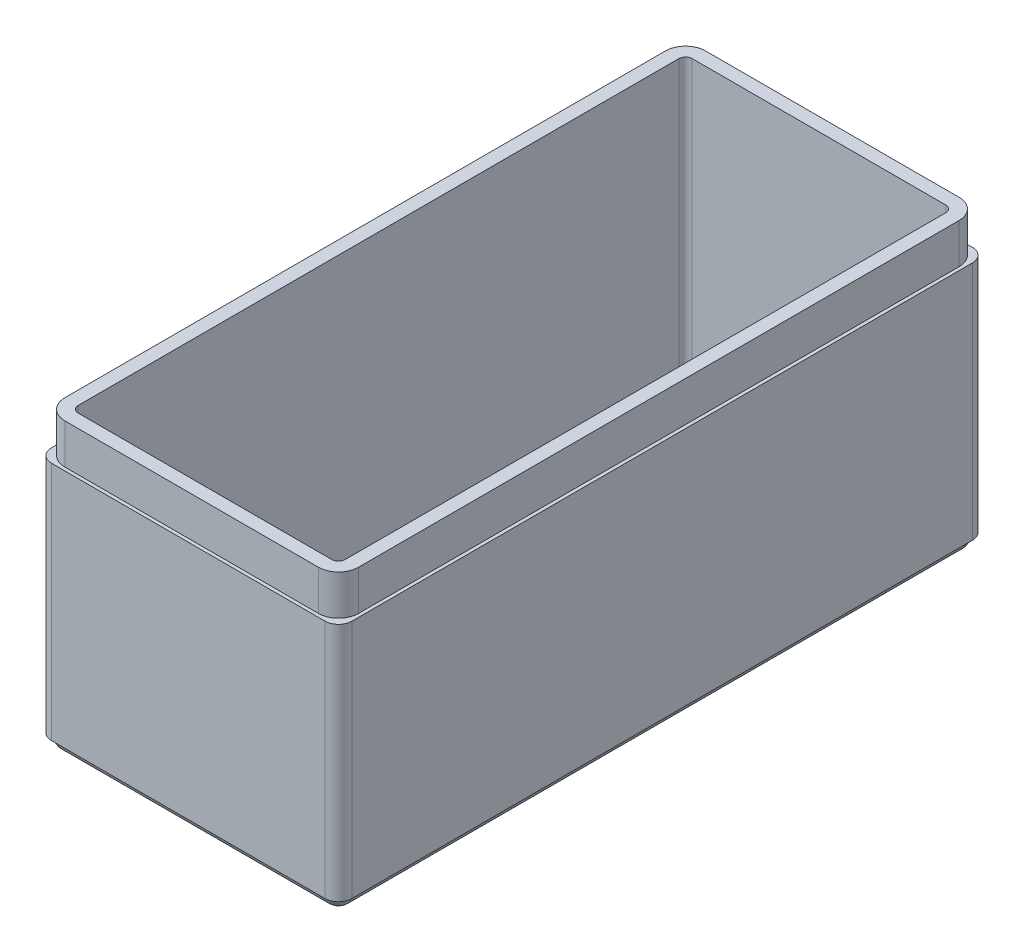
from build123d import *

# Parameters (mm, degrees)
SKETCH1_W           = 45
SKETCH1_H           = 97
BOSS_EXTRUDE1_DEPTH = 19
SKETCH2_W           = 44
SKETCH2_H           = 96
BOSS_EXTRUDE2_DEPTH = 6
SKETCH3_W           = 45
SKETCH3_H           = 97
SKETCH3_W_2         = 44
SKETCH3_H_2         = 96
CUT_EXTRUDE1_DEPTH  = 2
FILLET1_R           = 2
FILLET4_R           = 3
FILLET5_R           = 2
SHELL2_START        = -17
SHELL2_DEPTH        = 42
SHELL2_2_OUTLINE_W  = 41
SHELL2_2_OUTLINE_H  = 93
SHELL2_2_DEPTH      = 34
BOSS_EXTRUDE3_START = 34
SKETCH4_W           = 41
SKETCH4_H           = 93
BOSS_EXTRUDE3_DEPTH = 34


# Read off the part's stored shape, not the designer's step: Shell2
with BuildPart() as part:
    # Sketch1 → Boss-Extrude1 (new, symmetric)
    with BuildSketch(Plane(origin=(0, 0, 0), x_dir=(1, 0, 0), z_dir=(0, 1, 0))):
        Rectangle(SKETCH1_W, SKETCH1_H)
    extrude(amount=BOSS_EXTRUDE1_DEPTH, both=True)

    # Sketch2 → Boss-Extrude2 (add)
    with BuildSketch(Plane(origin=(0, 19, 0), x_dir=(1, 0, 0), z_dir=(0, 1, 0))):
        Rectangle(SKETCH2_W, SKETCH2_H)
    extrude(amount=BOSS_EXTRUDE2_DEPTH)

    # Sketch3 → Cut-Extrude1 (cut)
    with BuildSketch(Plane.XZ.offset(19)):
        Rectangle(SKETCH3_W, SKETCH3_H)
        Rectangle(SKETCH3_W_2, SKETCH3_H_2, mode=Mode.SUBTRACT)
    extrude(amount=-CUT_EXTRUDE1_DEPTH, mode=Mode.SUBTRACT)

    # Fillet1
    fillet1_edges = [part.edges().sort_by_distance(p)[0] for p in [
        (22, -19, 0),
        (22, -18, -48),
        (0, -19, -48),
        (-22, -18, -48),
        (-22, -19, 0),
        (-22, -18, 48),
        (0, -19, 48),
        (22, -18, 48),
    ]]
    fillet(fillet1_edges, radius=FILLET1_R - 0.0001)  # a hair under: the kernel refuses the full size

    # Fillet4
    fillet4_edges = [part.edges().sort_by_distance(p)[0] for p in [
        (22, 22, 48),
        (22, 22, -48),
        (-22, 22, -48),
        (-22, 22, 48),
    ]]
    fillet(fillet4_edges, radius=FILLET4_R)

    # Fillet5
    fillet5_edges = [part.edges().sort_by_distance(p)[0] for p in [
        (22.5, 1, 48.5),
        (-22.5, 1, 48.5),
        (-22.5, 1, -48.5),
        (22.5, 1, -48.5),
    ]]
    fillet(fillet5_edges, radius=FILLET5_R)

    # Shell2 outline → Shell2 (cut)
    with BuildSketch(Plane(origin=(0, 0, 0), x_dir=(1, 0, 0), z_dir=(0, 1, 0)).offset(SHELL2_START)):
        with BuildLine():
            Line((20, -45), (20, 45))
            ThreePointArc((20, 45), (19.707106781, 45.707106781), (19, 46))
            Line((19, 46), (-19, 46))
            ThreePointArc((-19, 46), (-19.707106781, 45.707106781), (-20, 45))
            Line((-20, 45), (-20, -45))
            ThreePointArc((-20, -45), (-19.707106781, -45.707106781), (-19, -46))
            Line((-19, -46), (19, -46))
            ThreePointArc((19, -46), (19.707106781, -45.707106781), (20, -45))
        make_face()
    extrude(amount=SHELL2_DEPTH, mode=Mode.SUBTRACT)

    # Shell2 2 outline → Shell2 2 (cut)
    with BuildSketch(Plane(origin=(0, 0, 0), x_dir=(1, 0, 0), z_dir=(0, 1, 0)).offset(SHELL2_START)):
        Rectangle(SHELL2_2_OUTLINE_W, SHELL2_2_OUTLINE_H)
        with BuildLine():
            ThreePointArc((19, 46), (19.707106781, 45.707106781), (20, 45))
            Line((20, 45), (20, -45))
            ThreePointArc((20, -45), (19.707106781, -45.707106781), (19, -46))
            Line((19, -46), (-19, -46))
            ThreePointArc((-19, -46), (-19.707106781, -45.707106781), (-20, -45))
            Line((-20, -45), (-20, 45))
            ThreePointArc((-20, 45), (-19.707106781, 45.707106781), (-19, 46))
            Line((-19, 46), (19, 46))
        make_face(mode=Mode.SUBTRACT)
    extrude(amount=SHELL2_2_DEPTH, mode=Mode.SUBTRACT)

    # Sketch4 → Boss-Extrude3 (add)
    with BuildSketch(Plane.XZ.offset(-17).offset(BOSS_EXTRUDE3_START)):
        Rectangle(SKETCH4_W, SKETCH4_H)
        with BuildLine():
            Line((19, -46), (-19, -46))
            ThreePointArc((-19, -46), (-19.707106781, -45.707106781), (-20, -45))
            Line((-20, -45), (-20, 45))
            ThreePointArc((-20, 45), (-19.707106781, 45.707106781), (-19, 46))
            Line((-19, 46), (19, 46))
            ThreePointArc((19, 46), (19.707106781, 45.707106781), (20, 45))
            Line((20, 45), (20, -45))
            ThreePointArc((20, -45), (19.707106781, -45.707106781), (19, -46))
        make_face(mode=Mode.SUBTRACT)
    extrude(amount=-BOSS_EXTRUDE3_DEPTH)


solid = part.part
